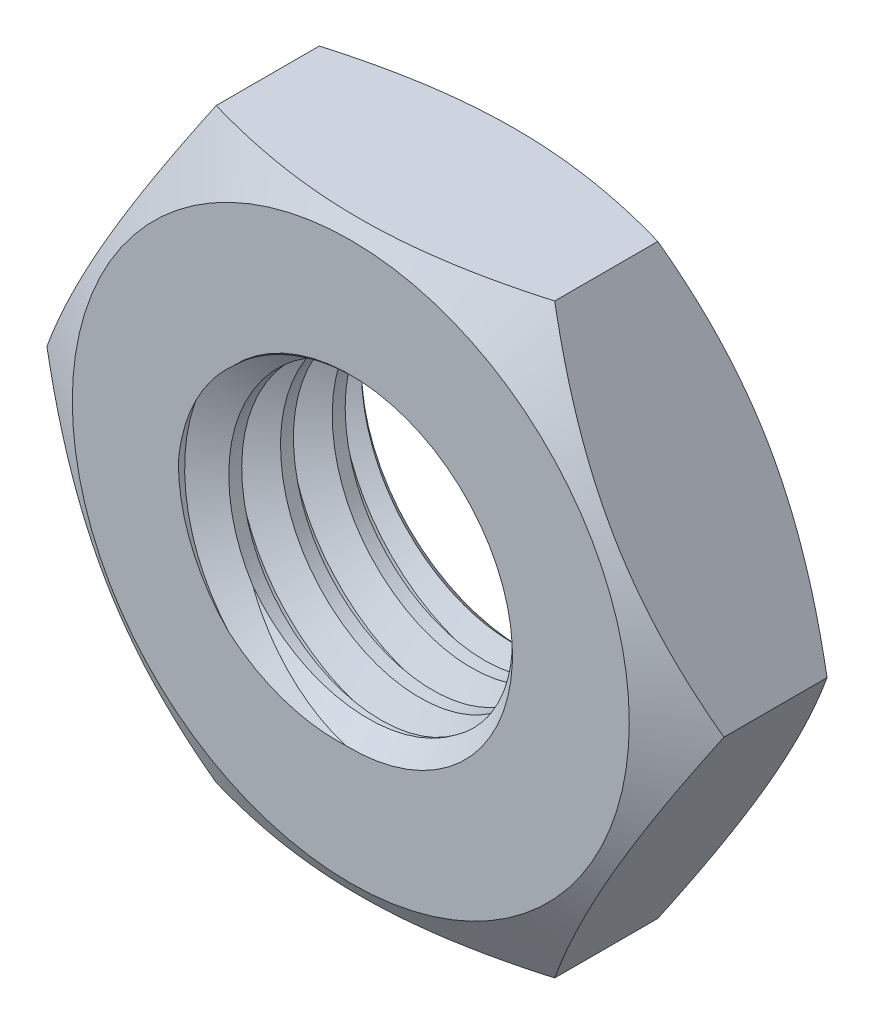
from build123d import *

# Parameters (mm, degrees)
BASENUTSKE_R            = 5
BASENUT_DEPTH           = 5
SKETCH6_OUTSIDE_W       = 78.58
SKETCH6_OUTSIDE_H       = 75.95
SKETCH6_OUTSIDE_R       = 8.075
CUT_EXTRUDE2_DEPTH      = 14.913422776
CUT_EXTRUDE2_DRAFT      = -60
MIRROR1_COPY_1_SKETCH_W = 78.58
MIRROR1_COPY_1_SKETCH_H = 75.95
MIRROR1_COPY_1_SKETCH_R = 8.075
MIRROR1_COPY_1_DEPTH    = 14.913422776
MIRROR1_COPY_1_DRAFT    = -60
SWEEP_1_PITCH           = 1.5
SKETCH_3_R              = 8.075
CUT_EXTRUDE_1_DEPTH     = 10
SKETCH_4_R              = 8.075
CUT_EXTRUDE_2_DEPTH     = 10


with BuildPart() as part:
    # BaseNutSke → BaseNut (new body)
    with BuildSketch(Plane.XY):
        Polygon((4.907477288, -8.5), (-4.907477288, -8.5), (-9.814954576, 0), (-4.907477288, 8.5), (4.907477288, 8.5), (9.814954576, 0), align=None)
        Circle(BASENUTSKE_R, mode=Mode.SUBTRACT)
    extrude(amount=-BASENUT_DEPTH)


with BuildPart() as cut_extrude2_tool:
    # Sketch6 outside → Cut-Extrude2 (with draft: the straight prism first)
    with BuildSketch(Plane(origin=(0, 0, -5), x_dir=(-1, 0, 0), z_dir=(0, 0, -1))):
        Rectangle(SKETCH6_OUTSIDE_W, SKETCH6_OUTSIDE_H)
        Circle(SKETCH6_OUTSIDE_R, mode=Mode.SUBTRACT)
    extrude(amount=-CUT_EXTRUDE2_DEPTH)
    # Cut-Extrude2: the draft: its side faces are tilted about the plane it starts from
    cut_extrude2_sides = [cut_extrude2_tool.faces().sort_by_distance(p)[0] for p in [
        (0, -37.975, 2.456711388),
        (-39.29, 0, 2.456711388),
        (0, 37.975, 2.456711388),
        (39.29, 0, 2.456711388),
        (8.075, 0, 2.456711388),
    ]]
    draft(cut_extrude2_sides, Plane(origin=(0, 0, -5), x_dir=(-1, 0, 0), z_dir=(0, 0, -1)), CUT_EXTRUDE2_DRAFT)


with BuildPart() as part_1:
    add(part.part)

    # Cut-Extrude2: cut by cut_extrude2_tool
    add(cut_extrude2_tool.part, mode=Mode.SUBTRACT)


with BuildPart() as mirror1_copy_1_tool:
    # Mirror1 copy 1 sketch → Mirror1 copy 1 (with draft: the straight prism first)
    with BuildSketch(Plane(origin=(0, 0, 0), x_dir=(-1, 0, 0), z_dir=(0, 0, 1))):
        Rectangle(MIRROR1_COPY_1_SKETCH_W, MIRROR1_COPY_1_SKETCH_H)
        Circle(MIRROR1_COPY_1_SKETCH_R, mode=Mode.SUBTRACT)
    extrude(amount=-MIRROR1_COPY_1_DEPTH)
    # Mirror1 copy 1: the draft: its side faces are tilted about the plane it starts from
    mirror1_copy_1_sides = [mirror1_copy_1_tool.faces().sort_by_distance(p)[0] for p in [
        (0, -37.975, -7.456711388),
        (-39.29, 0, -7.456711388),
        (0, 37.975, -7.456711388),
        (39.29, 0, -7.456711388),
        (8.075, 0, -7.456711388),
    ]]
    draft(mirror1_copy_1_sides, Plane(origin=(0, 0, 0), x_dir=(-1, 0, 0), z_dir=(0, 0, 1)), MIRROR1_COPY_1_DRAFT)


with BuildPart() as part_2:
    add(part_1.part)

    # Mirror1 copy 1: cut by mirror1_copy_1_tool
    add(mirror1_copy_1_tool.part, mode=Mode.SUBTRACT)

    # По траектории1: the profile of Эскиз2 profile screwed along a right-hand helix of 4 turns, 8 arcs to a turn; built about Z, then put on its axis
    sweep_1_z = Axis((0, 0, 0), (0, 0, 1))
    sweep_1_corners = [(5.0003, 0, 0.000173205), (5.0003, 0, -1.312512367), (4.188, 0, -0.843530744), (4.188, 0, -0.468808419)]
    with BuildLine(mode=Mode.PRIVATE) as sweep_1_profile:
        Line(sweep_1_corners[0], sweep_1_corners[1])
        Line(sweep_1_corners[1], sweep_1_corners[2])
        Line(sweep_1_corners[2], sweep_1_corners[3])
        Line(sweep_1_corners[3], sweep_1_corners[0])
    sweep_1_cap = Face(sweep_1_profile.wire())
    sweep_1_turn_angles = [0, 22.5, 45, 67.5, 90, 112.5, 135, 157.5, 180, 202.5, 225, 247.5, 270, 292.5, 315, 337.5, 360]
    sweep_1_turn_weights = [1, 0.9238795325112867, 1, 0.9238795325112867, 1, 0.9238795325112867, 1, 0.9238795325112867, 1, 0.9238795325112867, 1, 0.9238795325112867, 1, 0.9238795325112867, 1, 0.9238795325112867, 1]
    sweep_1_turn_rails = [Edge.make_bspline([Vector(p[0], p[1], 0).rotate(sweep_1_z, sweep_1_turn_angles[k]) / sweep_1_turn_weights[k] + Vector(0, 0, p[2] + SWEEP_1_PITCH * sweep_1_turn_angles[k] / 360) for k in range(17)], [0, 0, 0, 1, 1, 2, 2, 3, 3, 4, 4, 5, 5, 6, 6, 7, 7, 8, 8, 8], 2, sweep_1_turn_weights) for p in sweep_1_corners]
    sweep_1_turn_sides = [Face.make_surface_from_curves(sweep_1_turn_rails[p[0]], sweep_1_turn_rails[p[1]]) for p in [(0, 1), (1, 2), (2, 3), (3, 0)]]
    sweep_1 = Plane(origin=(0, 0, 0), x_dir=(-1, 0, 0), z_dir=(0, 0, -1)) * Solid(Shell([*[p.moved(Location((0, 0, SWEEP_1_PITCH * i))) for i in range(4) for p in sweep_1_turn_sides], sweep_1_cap, sweep_1_cap.rotate(sweep_1_z, 1440).moved(Location((0, 0, SWEEP_1_PITCH * 1440 / 360)))]))
    add(sweep_1)

    # Эскиз3 → Вырез-Вытянуть1 (cut)
    with BuildSketch(Plane.XY):
        Circle(SKETCH_3_R)
    extrude(amount=CUT_EXTRUDE_1_DEPTH, mode=Mode.SUBTRACT)

    # Эскиз4 → Вырез-Вытянуть2 (cut)
    with BuildSketch(Plane(origin=(0, 0, -5), x_dir=(-1, 0, 0), z_dir=(0, 0, -1))):
        Circle(SKETCH_4_R)
    extrude(amount=CUT_EXTRUDE_2_DEPTH, mode=Mode.SUBTRACT)

    # Эскиз5 → Вырез-Повернуть1 (revolve, cut)
    with BuildSketch(Plane(origin=(0, 0, 0), x_dir=(0, 0, -1), z_dir=(1, 0, 0))):
        Polygon((5.1, 4.188), (4.5, 4.188), (5.1, 4.788), align=None)
        Polygon((-0.1, 4.788), (-0.1, 4.188), (0.5, 4.188), align=None)
    revolve(axis=Axis((0, 0, 0), (0, 0, -1)), mode=Mode.SUBTRACT)


solid = part_2.part
